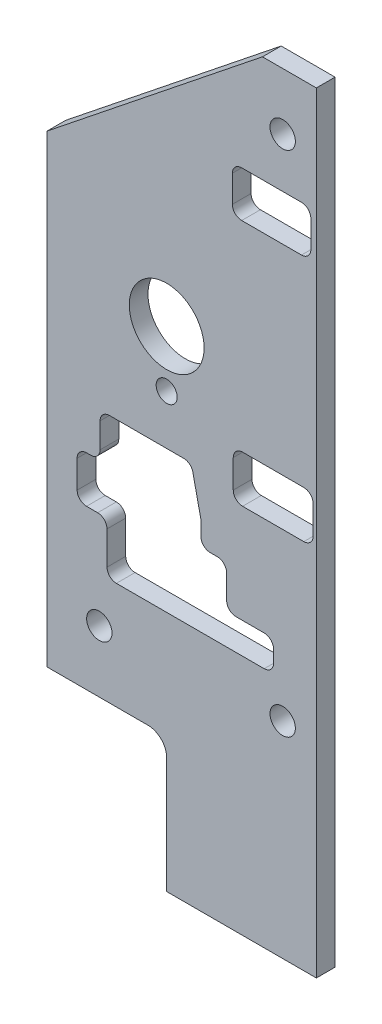
from build123d import *

# Parameters (mm, degrees)
BOSS_EXTRUDE1_DEPTH             = 3.175
F_6_CLEARANCE_HOLE1_D           = 4.3053
F_1_2_0_5_DIAMETER_HOLE1_D      = 12.7
F_9_64_0_14063_DIAMETER_HOLE1_D = 3.572002
CUT_EXTRUDE1_DEPTH              = 139.606115035


with BuildPart() as part:
    # Sketch1 → Boss-Extrude1 (new body)
    with BuildSketch(Plane.XY):
        with BuildLine():
            Line((-25.4, 0), (0, 0))
            Line((0, 0), (0, 130.81))
            Line((0, 130.81), (-9.144, 130.81))
            Line((-9.144, 130.81), (-45.72, 101.6))
            Line((-45.72, 101.6), (-45.72, 22.86))
            Line((-45.72, 22.86), (-28.575, 22.86))
            ThreePointArc((-28.575, 22.86), (-26.32993597, 21.93006403), (-25.4, 19.685))
            Line((-25.4, 19.685), (-25.4, 0))
        make_face()
    extrude(amount=-BOSS_EXTRUDE1_DEPTH)

    # #6 Clearance Hole1 (through all)
    with Locations(Plane.XY):
        with Locations((-5.715, 34.925), (-36.83, 33.3375), (-5.715, 121.158)):
            Hole(F_6_CLEARANCE_HOLE1_D / 2)

    # 1/2 (0.5) Diameter Hole1 (through all)
    with Locations(Plane.XY):
        with Locations((-25.4, 83.058)):
            Hole(F_1_2_0_5_DIAMETER_HOLE1_D / 2)

    # 9/64 (0.14063) Diameter Hole1 (through all)
    with Locations(Plane.XY):
        with Locations((-25.4, 73.533)):
            Hole(F_9_64_0_14063_DIAMETER_HOLE1_D / 2)

    # Sketch8 → Cut-Extrude1 (cut, through all)
    with BuildSketch(Plane.XY):
        with BuildLine():
            Line((-40.593999732, 56.096986297), (-40.593999732, 51.40816722))
            ThreePointArc((-40.593999732, 51.40816722), (-40.129031748, 50.285635205), (-39.006499732, 49.82066722))
            Line((-39.006499732, 49.82066722), (-37.113791774, 49.82066722))
            ThreePointArc((-37.113791774, 49.82066722), (-35.991259758, 49.355699235), (-35.526291774, 48.23316722))
            Line((-35.526291774, 48.23316722), (-35.526291774, 42.619818193))
            ThreePointArc((-35.526291774, 42.619818193), (-35.061323789, 41.497286178), (-33.938791774, 41.032318193))
            Line((-33.938791774, 41.032318193), (-8.847410579, 41.032318193))
            ThreePointArc((-8.847410579, 41.032318193), (-7.724878564, 41.497286178), (-7.259910579, 42.619818193))
            Line((-7.259910579, 42.619818193), (-7.259910579, 44.691199124))
            ThreePointArc((-7.259910579, 44.691199124), (-7.724878564, 45.813731139), (-8.847410579, 46.278699124))
            Line((-8.847410579, 46.278699124), (-13.638817348, 46.278699124))
            ThreePointArc((-13.638817348, 46.278699124), (-14.761349363, 46.743667109), (-15.226317348, 47.866199124))
            Line((-15.226317348, 47.866199124), (-15.226317348, 51.92674585))
            ThreePointArc((-15.226317348, 51.92674585), (-15.691285333, 53.049277865), (-16.813817348, 53.51424585))
            Line((-16.813817348, 53.51424585), (-18.016182899, 53.51424585))
            ThreePointArc((-18.016182899, 53.51424585), (-19.138714914, 53.979213835), (-19.603682899, 55.10174585))
            Line((-19.603682899, 55.10174585), (-19.603682899, 57.480701013))
            ThreePointArc((-19.603682899, 57.480701013), (-19.612844029, 57.651002697), (-19.640221688, 57.819338832))
            Line((-19.640221688, 57.819338832), (-20.960504493, 63.866234079))
            ThreePointArc((-20.960504493, 63.866234079), (-21.515833063, 64.764071854), (-22.511465704, 65.11509626))
            Line((-22.511465704, 65.11509626), (-35.115075228, 65.11509626))
            ThreePointArc((-35.115075228, 65.11509626), (-36.237607243, 64.650128275), (-36.702575228, 63.52759626))
            Line((-36.702575228, 63.52759626), (-36.702575228, 59.271986297))
            ThreePointArc((-36.702575228, 59.271986297), (-37.167543213, 58.149454282), (-38.290075228, 57.684486297))
            Line((-38.290075228, 57.684486297), (-39.006499732, 57.684486297))
            ThreePointArc((-39.006499732, 57.684486297), (-40.129031748, 57.219518312), (-40.593999732, 56.096986297))
        make_face()
        with BuildLine():
            Line((-12.66940386, 112.734265078), (-2.525531471, 112.734265078))
            ThreePointArc((-2.525531471, 112.734265078), (-1.402999456, 112.269297093), (-0.938031471, 111.146765078))
            Line((-0.938031471, 111.146765078), (-0.938031471, 106.577446256))
            ThreePointArc((-0.938031471, 106.577446256), (-1.402999456, 105.454914241), (-2.525531471, 104.989946256))
            Line((-2.525531471, 104.989946256), (-12.66940386, 104.989946256))
            ThreePointArc((-12.66940386, 104.989946256), (-13.791935875, 105.454914241), (-14.25690386, 106.577446256))
            Line((-14.25690386, 106.577446256), (-14.25690386, 111.146765078))
            ThreePointArc((-14.25690386, 111.146765078), (-13.791935875, 112.269297093), (-12.66940386, 112.734265078))
        make_face()
        with BuildLine():
            Line((-12.516611138, 71.025656121), (-2.129196575, 71.025656121))
            ThreePointArc((-2.129196575, 71.025656121), (-1.00666456, 70.560688136), (-0.541696575, 69.438156121))
            Line((-0.541696575, 69.438156121), (-0.541696575, 64.655332835))
            ThreePointArc((-0.541696575, 64.655332835), (-1.00666456, 63.53280082), (-2.129196575, 63.067832835))
            Line((-2.129196575, 63.067832835), (-12.516611138, 63.067832835))
            ThreePointArc((-12.516611138, 63.067832835), (-13.639143154, 63.53280082), (-14.104111138, 64.655332835))
            Line((-14.104111138, 64.655332835), (-14.104111138, 69.438156121))
            ThreePointArc((-14.104111138, 69.438156121), (-13.639143154, 70.560688136), (-12.516611138, 71.025656121))
        make_face()
    extrude(amount=-CUT_EXTRUDE1_DEPTH, mode=Mode.SUBTRACT)


solid = part.part
